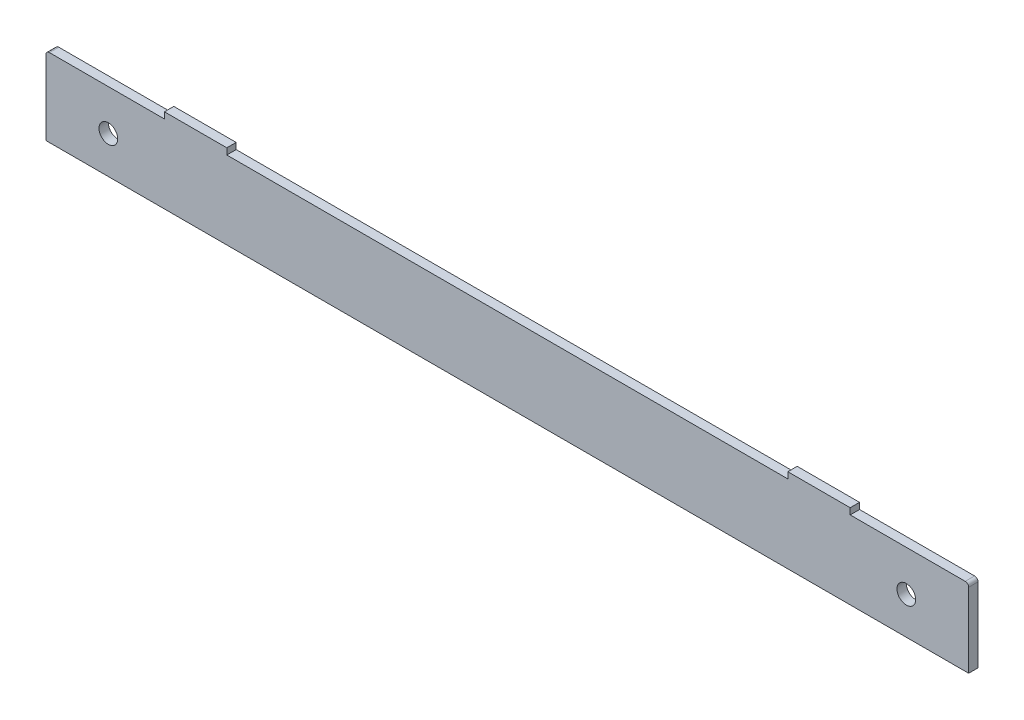
from build123d import *

# Parameters (mm, degrees)
SM_BASE_FLANGE_1_DEPTH = 3
SKETCH_4_W             = 20
SKETCH_4_H             = 3
EXTRUDE_1_DEPTH        = 2
SKETCH_5_R             = 3
CUT_EXTRUDE_1_DEPTH    = 10


# Sheet-metal steps are written as plain solids
with BuildPart() as part:
    # Sketch 1 → Базовая кромка1 (new body)
    with BuildSketch(Plane.XY):
        with BuildLine():
            Line((-52.715343227, 26.180564784), (241.084656773, 26.180564784))
            ThreePointArc((241.084656773, 26.180564784), (241.862474232, 25.858382243), (242.184656773, 25.080564784))
            Line((242.184656773, 25.080564784), (242.184656773, 1.180564784))
            Line((242.184656773, 1.180564784), (-53.815343227, 1.180564784))
            Line((-53.815343227, 1.180564784), (-53.815343227, 25.080564784))
            ThreePointArc((-53.815343227, 25.080564784), (-53.493160687, 25.858382243), (-52.715343227, 26.180564784))
        make_face()
    extrude(amount=-SM_BASE_FLANGE_1_DEPTH)

    # Эскиз4 → Бобышка-Вытянуть1 (add)
    with BuildSketch(Plane(origin=(0, 26.180564784, 0), x_dir=(1, 0, 0), z_dir=(0, 1, 0))):
        with Locations((-5.815343227, 1.5)):
            Rectangle(SKETCH_4_W, SKETCH_4_H)
        with Locations((194.184656773, 1.5)):
            Rectangle(SKETCH_4_W, SKETCH_4_H)
    extrude(amount=EXTRUDE_1_DEPTH)

    # Эскиз5 → Вырез-Вытянуть1 (cut)
    with BuildSketch(Plane(origin=(0, 0, -3), x_dir=(-1, 0, 0), z_dir=(0, 0, -1))):
        with Locations((-222.184656773, 13.130564784)):
            Circle(SKETCH_5_R)
        with Locations((33.815343227, 13.130564784)):
            Circle(SKETCH_5_R)
    extrude(amount=-CUT_EXTRUDE_1_DEPTH, mode=Mode.SUBTRACT)


solid = part.part
